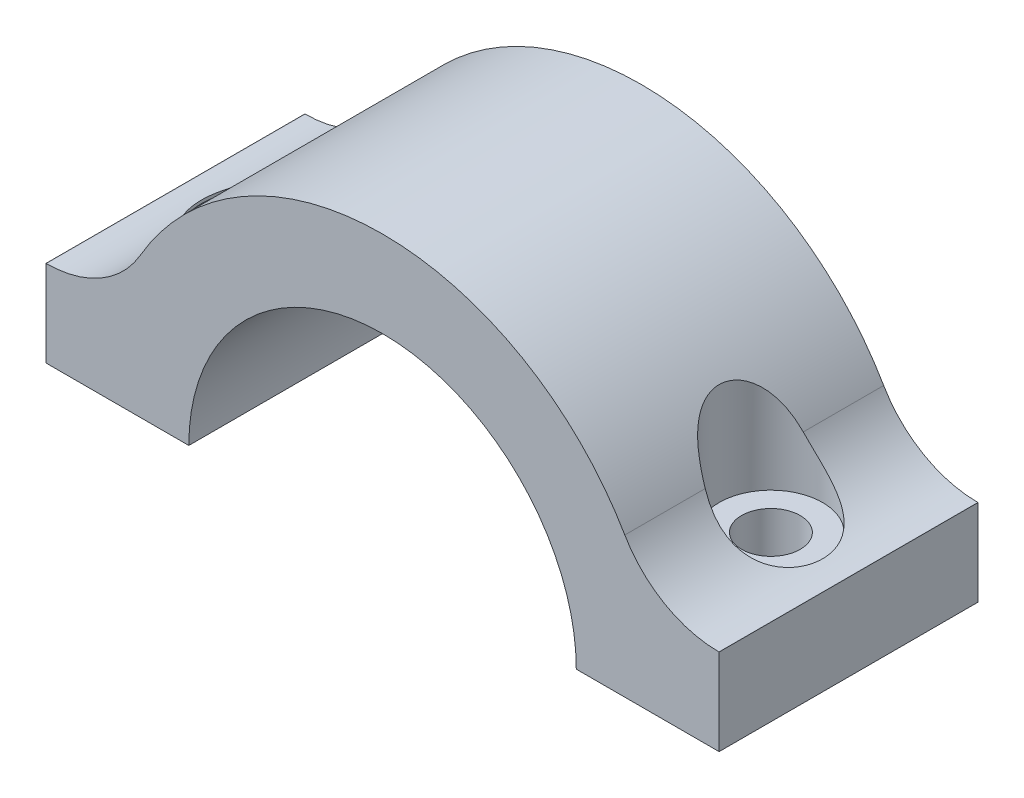
from build123d import *

# Parameters (mm, degrees)
Y_KSEKLIK_EKSTR_ZYON1_DEPTH = 15
IZIM2_R                     = 1.7
KES_EKSTR_ZYON2_DEPTH       = 15
RADYUS3_R                   = 6.3
IZIM3_R                     = 3
KES_EKSTR_ZYON3_DEPTH       = 15


with BuildPart() as part:
    # Çizim1 → Yükseklik-Ekstrüzyon1 (new body)
    with BuildSketch(Plane.XY):
        with BuildLine():
            Line((-19.5, 0), (-11.225, 0))
            ThreePointArc((-11.225, 0), (0, 11.225), (11.225, 0))
            Line((11.225, 0), (19.5, 0))
            Line((19.5, 0), (19.5, 5))
            Line((19.5, 5), (15.435369286, 5))
            ThreePointArc((15.435369286, 5), (0, 16.225), (-15.435369286, 5))
            Line((-15.435369286, 5), (-19.5, 5))
            Line((-19.5, 5), (-19.5, 0))
        make_face()
    extrude(amount=Y_KSEKLIK_EKSTR_ZYON1_DEPTH)

    # Çizim2 → Kes-Ekstrüzyon2 (cut)
    with BuildSketch(Plane.XZ):
        with Locations((-15, 7.5)):
            Circle(IZIM2_R)
        with Locations((15, 7.5)):
            Circle(IZIM2_R)
    extrude(amount=-KES_EKSTR_ZYON2_DEPTH, mode=Mode.SUBTRACT)

    # Radyus3
    # the kernel refuses this fillet: 6.3 mm, written as the material it adds along each edge
    with BuildSketch(Plane(origin=(-15.435369286, 5, -0.982079778), x_dir=(-1, 0, 0), z_dir=(0, 0, 1))) as radyus3_piece_1_section:
        with BuildLine():
            CenterArc((4.050154186, -6.3), RADYUS3_R, 90, 59.889795344)
            ThreePointArc((-1.399736951, -3.139511654), (-0.61649222, -1.60692875), (0, 0))
            Line((0, 0), (4.050154186, 0))
        make_face()
    radyus3_piece_1 = extrude(amount=15.982079778, mode=Mode.PRIVATE)
    radyus3_piece_1 = split(radyus3_piece_1, bisect_by=Plane(origin=(-18.387347424, 5.060237856, 0), z_dir=(0, 0, 1)), keep=Keep.TOP, mode=Mode.PRIVATE)
    radyus3_piece_1 = radyus3_piece_1 - Plane(origin=(-15, 5.060237856, 7.5), x_dir=(1, 0, 0), z_dir=(0, -1, 0)) * Cylinder(1.7, 49, mode=Mode.PRIVATE)
    add(radyus3_piece_1)
    with BuildSketch(Plane(origin=(15.435369286, 5, -0.982079778), x_dir=(-0.4072067026202576, 0.9133360287107571, 0), z_dir=(0, 0, 1))) as radyus3_piece_2_section:
        with BuildLine():
            CenterArc((4.10476705, -6.264553967), RADYUS3_R, 96.080720065, 59.889795344)
            Line((-1.649249931, -3.69915174), (0, 0))
            ThreePointArc((0, 0), (1.718705687, -0.091287601), (3.437411374, 0))
        make_face()
    radyus3_piece_2 = extrude(amount=15.982079778, mode=Mode.PRIVATE)
    radyus3_piece_2 = split(radyus3_piece_2, bisect_by=Plane(origin=(14.638658108, 7.219740405, 0), z_dir=(0, 0, 1)), keep=Keep.TOP, mode=Mode.PRIVATE)
    radyus3_piece_2 = radyus3_piece_2 - Plane(origin=(15, 7.219740405, 7.5), x_dir=(1, 0, 0), z_dir=(0, -1, 0)) * Cylinder(1.7, 47, mode=Mode.PRIVATE)
    add(radyus3_piece_2)

    # Çizim3 → Kes-Ekstrüzyon3 (cut)
    with BuildSketch(Plane(origin=(0, 5, 0), x_dir=(1, 0, 0), z_dir=(0, 1, 0))):
        with Locations(Location((-15, -7.5, 0), (0, 0, 71.249080341))):
            Circle(IZIM3_R)
        with Locations(Location((15, -7.5, 0), (0, 0, 108.750992195))):
            Circle(IZIM3_R)
    extrude(amount=KES_EKSTR_ZYON3_DEPTH, mode=Mode.SUBTRACT)


solid = part.part
